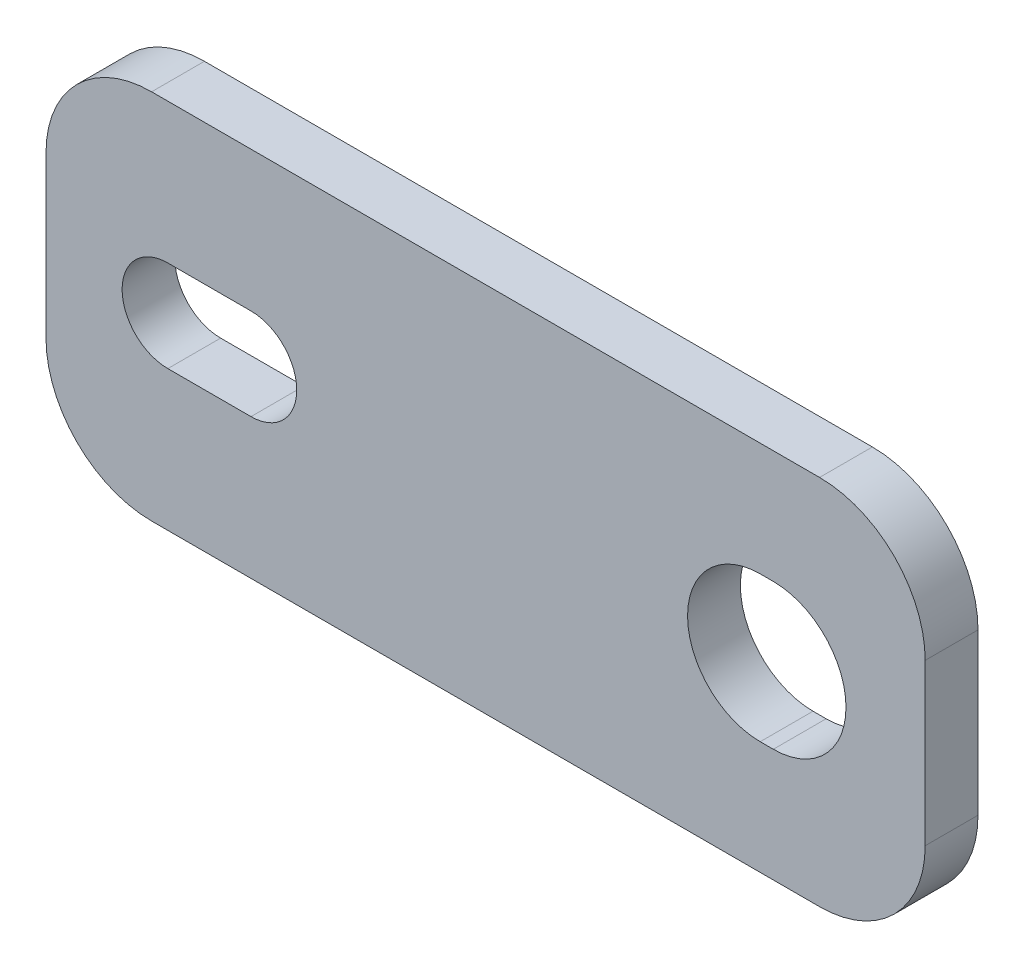
from build123d import *

# Parameters (mm, degrees)
SKETCH1_W          = 52.8624
SKETCH1_H          = 22.352
BASE_FLANGE1_DEPTH = 3.175
CUT_EXTRUDE1_DEPTH = 3.175
FILLET1_R          = 6.35


# Sheet-metal steps are written as plain solids
with BuildPart() as part:
    # Sketch1 → Base-Flange1 (new body)
    with BuildSketch(Plane.XY):
        with Locations((26.4312, 11.176)):
            Rectangle(SKETCH1_W, SKETCH1_H)
    extrude(amount=-BASE_FLANGE1_DEPTH)

    # Sketch6 → Cut-Extrude1 (cut)
    with BuildSketch(Plane.XY):
        with BuildLine():
            Line((7.325, 13.926), (12.325, 13.926))
            ThreePointArc((12.325, 13.926), (15.075, 11.176), (12.325, 8.426))
            Line((12.325, 8.426), (7.325, 8.426))
            ThreePointArc((7.325, 8.426), (4.575, 11.176), (7.325, 13.926))
        make_face()
        with BuildLine():
            Line((42.9437, 6.8072), (43.7311, 6.8072))
            ThreePointArc((43.7311, 6.8072), (48.0999, 11.176), (43.7311, 15.5448))
            Line((43.7311, 15.5448), (42.9437, 15.5448))
            ThreePointArc((42.9437, 15.5448), (38.5749, 11.176), (42.9437, 6.8072))
        make_face()
    extrude(amount=-CUT_EXTRUDE1_DEPTH, mode=Mode.SUBTRACT)

    # Fillet1
    fillet1_edges = [part.edges().sort_by_distance(p)[0] for p in [
        (0, 22.352, -1.5875),
        (52.8624, 22.352, -1.5875),
        (52.8624, 0, -1.5875),
        (0, 0, -1.5875),
    ]]
    fillet(fillet1_edges, radius=FILLET1_R)


solid = part.part
